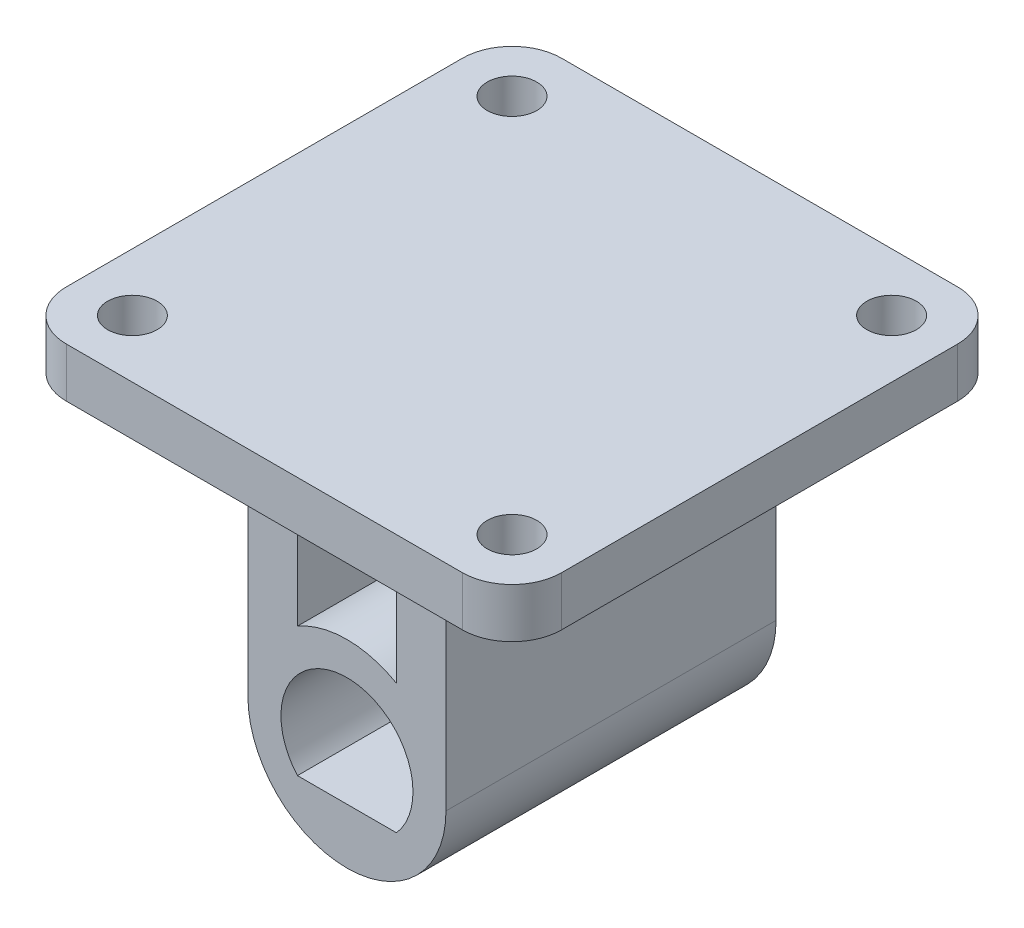
from build123d import *

# Parameters (mm, degrees)
CROQUIS1_W              = 30
CROQUIS1_H              = 30
SALIENTE_EXTRUIR1_DEPTH = 3
SALIENTE_EXTRUIR2_DEPTH = 20
CROQUIS4_R              = 1.5
CORTAR_EXTRUIR1_DEPTH   = 33.031234756
REDONDEO2_R             = 3
REDONDEO4_R             = 2
REDONDEO5_R             = 3


with BuildPart() as part:
    # Croquis1 → Saliente-Extruir1 (new body)
    with BuildSketch(Plane(origin=(0, 0, 0), x_dir=(1, 0, 0), z_dir=(0, 1, 0))):
        Rectangle(CROQUIS1_W, CROQUIS1_H)
    extrude(amount=SALIENTE_EXTRUIR1_DEPTH)

    # Croquis3 → Saliente-Extruir2 (add)
    with BuildSketch(Plane.XY.offset(10)):
        with BuildLine():
            Line((-3, 0), (-3, -9.803847577))
            ThreePointArc((-3, -9.803847577), (0, -9), (3, -9.803847577))
            Line((3, -9.803847577), (3, 0))
            Line((3, 0), (6, 0))
            Line((6, 0), (6, -15))
            ThreePointArc((6, -15), (0, -21), (-6, -15))
            Line((-6, -15), (-6, 0))
            Line((-6, 0), (-3, 0))
        make_face()
        with BuildLine():
            Line((-3, -17.645751311), (3, -17.645751311))
            ThreePointArc((3, -17.645751311), (0, -11), (-3, -17.645751311))
        make_face(mode=Mode.SUBTRACT)
    extrude(amount=-SALIENTE_EXTRUIR2_DEPTH)

    # Croquis4 → Cortar-Extruir1 (cut, through all)
    with BuildSketch(Plane(origin=(0, 3, 0), x_dir=(1, 0, 0), z_dir=(0, 1, 0))):
        with Locations((-11.5, 11.5)):
            Circle(CROQUIS4_R)
        with Locations((11.5, 11.5)):
            Circle(CROQUIS4_R)
        with Locations((11.5, -11.5)):
            Circle(CROQUIS4_R)
        with Locations((-11.5, -11.5)):
            Circle(CROQUIS4_R)
    extrude(amount=-CORTAR_EXTRUIR1_DEPTH, mode=Mode.SUBTRACT)

    # Redondeo2
    redondeo2_edges = [part.edges().sort_by_distance(p)[0] for p in [
        (15, 1.5, -15),
        (-15, 1.5, -15),
        (15, 1.5, 15),
        (-15, 1.5, 15),
    ]]
    fillet(redondeo2_edges, radius=REDONDEO2_R)

    # Redondeo4
    redondeo4_edges = [part.edges().sort_by_distance(p)[0] for p in [
        (-3, 0, 0),
        (3, 0, 0),
    ]]
    fillet(redondeo4_edges, radius=REDONDEO4_R)

    # Redondeo5
    redondeo5_edges = [part.edges().sort_by_distance(p)[0] for p in [
        (3.5, 0, 10),
    ]]
    fillet(redondeo5_edges, radius=REDONDEO5_R)
    redondeo5_2_edges = [part.edges().sort_by_distance(p)[0] for p in [
        (3.5, 0, -10),
    ]]
    fillet(redondeo5_2_edges, radius=REDONDEO5_R)
    redondeo5_3_edges = [part.edges().sort_by_distance(p)[0] for p in [
        (-3.5, 0, 10),
    ]]
    fillet(redondeo5_3_edges, radius=REDONDEO5_R)
    redondeo5_4_edges = [part.edges().sort_by_distance(p)[0] for p in [
        (-3.5, 0, -10),
    ]]
    fillet(redondeo5_4_edges, radius=REDONDEO5_R)
    redondeo5_5_edges = [part.edges().sort_by_distance(p)[0] for p in [
        (-6, 0, 0),
    ]]
    fillet(redondeo5_5_edges, radius=REDONDEO5_R)
    redondeo5_6_edges = [part.edges().sort_by_distance(p)[0] for p in [
        (6, 0, 0),
    ]]
    fillet(redondeo5_6_edges, radius=REDONDEO5_R)


solid = part.part
